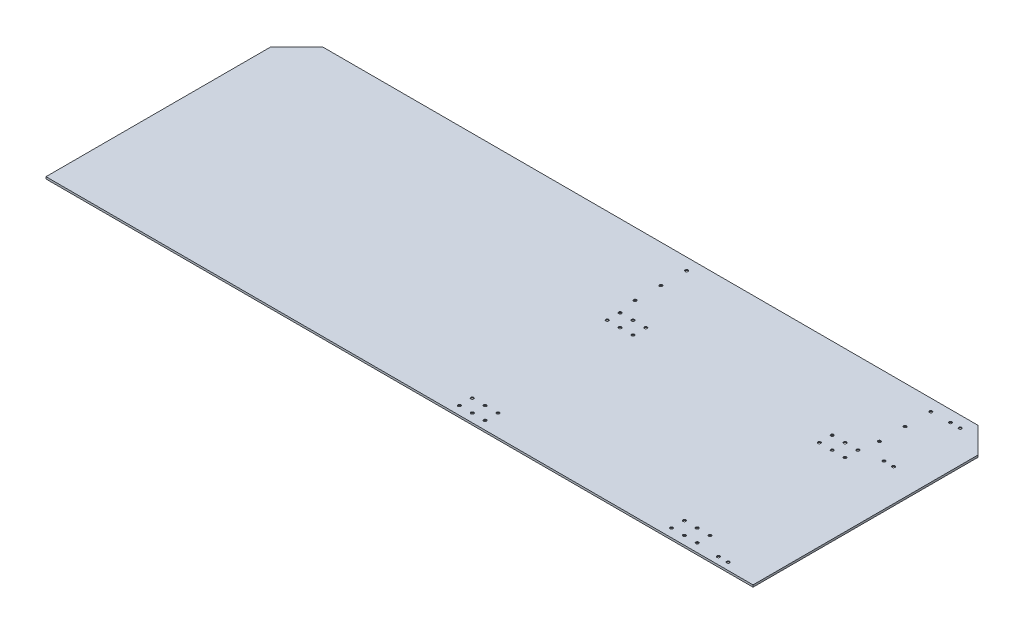
from build123d import *

# Parameters (mm, degrees)
SKETCH1_W                       = 1100
SKETCH1_H                       = 390
BOSS_EXTRUDE1_DEPTH             = 3.175
CHAMFER1_SIZE                   = 40
LAPTOP_SUPPORT_HOLES_AT_2_COUNT = 2
LAPTOP_SUPPORT_HOLES_AT_2_PITCH = 20
LAPTOP_SUPPORT_HOLES_AT_3_COUNT = 2
LAPTOP_SUPPORT_HOLES_AT_3_PITCH = 40
LAPTOP_SUPPORT_HOLES_AT_4_COUNT = 2
LAPTOP_SUPPORT_HOLES_AT_4_PITCH = 28.284271247
LAPTOP_SUPPORT_HOLES_AT_5_COUNT = 2
LAPTOP_SUPPORT_HOLES_AT_5_PITCH = 44.72135955
LAPTOP_SUPPORT_HOLES_AT_6_COUNT = 2
LAPTOP_SUPPORT_HOLES_AT_6_PITCH = 20
LPATTERN1_COUNT                 = 2
LPATTERN1_PITCH                 = 330
LPATTERN1_COUNT_DIR2            = 2
LPATTERN1_PITCH_DIR2            = 230
FAN_SUPPORT_HOLES_AT_2_COUNT    = 2
FAN_SUPPORT_HOLES_AT_2_PITCH    = 15
FAN_SUPPORT_HOLES_AT_3_COUNT    = 2
FAN_SUPPORT_HOLES_AT_3_PITCH    = 103.65
FAN_SUPPORT_HOLES_AT_4_COUNT    = 2
FAN_SUPPORT_HOLES_AT_4_PITCH    = 104.729759381
FAN_SUPPORT_HOLES_AT_5_COUNT    = 2
FAN_SUPPORT_HOLES_AT_5_PITCH    = 257.5
FAN_SUPPORT_HOLES_AT_6_COUNT    = 2
FAN_SUPPORT_HOLES_AT_6_PITCH    = 257.936523199
BACK_BAY_HOLES_AT_2_COUNT       = 2
BACK_BAY_HOLES_AT_2_PITCH       = 40
BACK_BAY_HOLES_AT_3_COUNT       = 2
BACK_BAY_HOLES_AT_3_PITCH       = 80
LPATTERN3_COUNT                 = 2
LPATTERN3_PITCH                 = 380


with BuildPart() as part:
    # Sketch1 → Boss-Extrude1 (new body)
    with BuildSketch(Plane(origin=(0, 0, 0), x_dir=(1, 0, 0), z_dir=(0, 1, 0))):
        Rectangle(SKETCH1_W, SKETCH1_H)
    extrude(amount=BOSS_EXTRUDE1_DEPTH)

    # Chamfer1
    chamfer1_edges = [part.edges().sort_by_distance(p)[0] for p in [
        (-550, 1.5875, -195),
        (550, 1.5875, -195),
    ]]
    chamfer(chamfer1_edges, length=CHAMFER1_SIZE)

    # Sketch13 → Laptop Support Holes (revolve, cut)
    with BuildSketch(Plane(origin=(450, 0, 181.825), x_dir=(0, 0, -1), z_dir=(1, 0, 0))):
        Polygon((0, 0), (0, 16.351936393), (2.25, 15), (2.25, 2.23), (4.48, 0), align=None)
    laptop_support_holes = revolve(axis=Axis((450, -6.35, 181.825), (0, 1, 0)), mode=Mode.SUBTRACT)

    # Laptop Support Holes at 2: Laptop Support Holes ×2
    with Locations(*[(-i * LAPTOP_SUPPORT_HOLES_AT_2_PITCH, 0, 0) for i in range(1, LAPTOP_SUPPORT_HOLES_AT_2_COUNT)]):
        add(laptop_support_holes, mode=Mode.SUBTRACT)

    # Laptop Support Holes at 3: Laptop Support Holes ×2
    with Locations(*[(-i * LAPTOP_SUPPORT_HOLES_AT_3_PITCH, 0, 0) for i in range(1, LAPTOP_SUPPORT_HOLES_AT_3_COUNT)]):
        add(laptop_support_holes, mode=Mode.SUBTRACT)

    # Laptop Support Holes at 4: Laptop Support Holes ×2
    with Locations(*[Vector(-0.7071067811865456, 0, -0.7071067811865496) * (i * LAPTOP_SUPPORT_HOLES_AT_4_PITCH) for i in range(1, LAPTOP_SUPPORT_HOLES_AT_4_COUNT)]):
        add(laptop_support_holes, mode=Mode.SUBTRACT)

    # Laptop Support Holes at 5: Laptop Support Holes ×2
    with Locations(*[Vector(-0.8944271909999156, 0, -0.4472135954999585) * (i * LAPTOP_SUPPORT_HOLES_AT_5_PITCH) for i in range(1, LAPTOP_SUPPORT_HOLES_AT_5_COUNT)]):
        add(laptop_support_holes, mode=Mode.SUBTRACT)

    # Laptop Support Holes at 6: Laptop Support Holes ×2
    with Locations(*[(0, 0, -i * LAPTOP_SUPPORT_HOLES_AT_6_PITCH) for i in range(1, LAPTOP_SUPPORT_HOLES_AT_6_COUNT)]):
        add(laptop_support_holes, mode=Mode.SUBTRACT)

    # LPattern1: Laptop Support Holes 2 × 2
    with Locations(*[(-i * LPATTERN1_PITCH, 0, -j * LPATTERN1_PITCH_DIR2) for i in range(LPATTERN1_COUNT) for j in range(LPATTERN1_COUNT_DIR2) if (i, j) != (0, 0)]):
        add(laptop_support_holes, mode=Mode.SUBTRACT)

    # LPattern1 copy 1 sketch → LPattern1 copy 1 (revolve, cut)
    with BuildSketch(Plane(origin=(430, 0, -48.175), x_dir=(0, 0, -1), z_dir=(1, 0, 0))):
        Polygon((0, 0), (0, 16.351936393), (2.25, 15), (2.25, 2.23), (4.48, 0), align=None)
    revolve(axis=Axis((430, -6.35, -48.175), (0, 1, 0)), mode=Mode.SUBTRACT)

    # LPattern1 copy 2 sketch → LPattern1 copy 2 (revolve, cut)
    with BuildSketch(Plane(origin=(100, 0, 181.825), x_dir=(0, 0, -1), z_dir=(1, 0, 0))):
        Polygon((0, 0), (0, 16.351936393), (2.25, 15), (2.25, 2.23), (4.48, 0), align=None)
    revolve(axis=Axis((100, -6.35, 181.825), (0, 1, 0)), mode=Mode.SUBTRACT)

    # LPattern1 copy 3 sketch → LPattern1 copy 3 (revolve, cut)
    with BuildSketch(Plane(origin=(100, 0, -48.175), x_dir=(0, 0, -1), z_dir=(1, 0, 0))):
        Polygon((0, 0), (0, 16.351936393), (2.25, 15), (2.25, 2.23), (4.48, 0), align=None)
    revolve(axis=Axis((100, -6.35, -48.175), (0, 1, 0)), mode=Mode.SUBTRACT)

    # LPattern1 copy 4 sketch → LPattern1 copy 4 (revolve, cut)
    with BuildSketch(Plane(origin=(410, 0, -48.175), x_dir=(0, 0, -1), z_dir=(1, 0, 0))):
        Polygon((0, 0), (0, 16.351936393), (2.25, 15), (2.25, 2.23), (4.48, 0), align=None)
    revolve(axis=Axis((410, -6.35, -48.175), (0, 1, 0)), mode=Mode.SUBTRACT)

    # LPattern1 copy 5 sketch → LPattern1 copy 5 (revolve, cut)
    with BuildSketch(Plane(origin=(80, 0, 181.825), x_dir=(0, 0, -1), z_dir=(1, 0, 0))):
        Polygon((0, 0), (0, 16.351936393), (2.25, 15), (2.25, 2.23), (4.48, 0), align=None)
    revolve(axis=Axis((80, -6.35, 181.825), (0, 1, 0)), mode=Mode.SUBTRACT)

    # LPattern1 copy 6 sketch → LPattern1 copy 6 (revolve, cut)
    with BuildSketch(Plane(origin=(80, 0, -48.175), x_dir=(0, 0, -1), z_dir=(1, 0, 0))):
        Polygon((0, 0), (0, 16.351936393), (2.25, 15), (2.25, 2.23), (4.48, 0), align=None)
    revolve(axis=Axis((80, -6.35, -48.175), (0, 1, 0)), mode=Mode.SUBTRACT)

    # LPattern1 copy 7 sketch → LPattern1 copy 7 (revolve, cut)
    with BuildSketch(Plane(origin=(430, 0, -68.175), x_dir=(0, 0, -1), z_dir=(1, 0, 0))):
        Polygon((0, 0), (0, 16.351936393), (2.25, 15), (2.25, 2.23), (4.48, 0), align=None)
    revolve(axis=Axis((430, -6.35, -68.175), (0, 1, 0)), mode=Mode.SUBTRACT)

    # LPattern1 copy 8 sketch → LPattern1 copy 8 (revolve, cut)
    with BuildSketch(Plane(origin=(100, 0, 161.825), x_dir=(0, 0, -1), z_dir=(1, 0, 0))):
        Polygon((0, 0), (0, 16.351936393), (2.25, 15), (2.25, 2.23), (4.48, 0), align=None)
    revolve(axis=Axis((100, -6.35, 161.825), (0, 1, 0)), mode=Mode.SUBTRACT)

    # LPattern1 copy 9 sketch → LPattern1 copy 9 (revolve, cut)
    with BuildSketch(Plane(origin=(100, 0, -68.175), x_dir=(0, 0, -1), z_dir=(1, 0, 0))):
        Polygon((0, 0), (0, 16.351936393), (2.25, 15), (2.25, 2.23), (4.48, 0), align=None)
    revolve(axis=Axis((100, -6.35, -68.175), (0, 1, 0)), mode=Mode.SUBTRACT)

    # LPattern1 copy 10 sketch → LPattern1 copy 10 (revolve, cut)
    with BuildSketch(Plane(origin=(410, 0, -68.175), x_dir=(0, 0, -1), z_dir=(1, 0, 0))):
        Polygon((0, 0), (0, 16.351936393), (2.25, 15), (2.25, 2.23), (4.48, 0), align=None)
    revolve(axis=Axis((410, -6.35, -68.175), (0, 1, 0)), mode=Mode.SUBTRACT)

    # LPattern1 copy 11 sketch → LPattern1 copy 11 (revolve, cut)
    with BuildSketch(Plane(origin=(80, 0, 161.825), x_dir=(0, 0, -1), z_dir=(1, 0, 0))):
        Polygon((0, 0), (0, 16.351936393), (2.25, 15), (2.25, 2.23), (4.48, 0), align=None)
    revolve(axis=Axis((80, -6.35, 161.825), (0, 1, 0)), mode=Mode.SUBTRACT)

    # LPattern1 copy 12 sketch → LPattern1 copy 12 (revolve, cut)
    with BuildSketch(Plane(origin=(80, 0, -68.175), x_dir=(0, 0, -1), z_dir=(1, 0, 0))):
        Polygon((0, 0), (0, 16.351936393), (2.25, 15), (2.25, 2.23), (4.48, 0), align=None)
    revolve(axis=Axis((80, -6.35, -68.175), (0, 1, 0)), mode=Mode.SUBTRACT)

    # LPattern1 copy 13 sketch → LPattern1 copy 13 (revolve, cut)
    with BuildSketch(Plane(origin=(450, 0, -68.175), x_dir=(0, 0, -1), z_dir=(1, 0, 0))):
        Polygon((0, 0), (0, 16.351936393), (2.25, 15), (2.25, 2.23), (4.48, 0), align=None)
    revolve(axis=Axis((450, -6.35, -68.175), (0, 1, 0)), mode=Mode.SUBTRACT)

    # LPattern1 copy 14 sketch → LPattern1 copy 14 (revolve, cut)
    with BuildSketch(Plane(origin=(120, 0, 161.825), x_dir=(0, 0, -1), z_dir=(1, 0, 0))):
        Polygon((0, 0), (0, 16.351936393), (2.25, 15), (2.25, 2.23), (4.48, 0), align=None)
    revolve(axis=Axis((120, -6.35, 161.825), (0, 1, 0)), mode=Mode.SUBTRACT)

    # LPattern1 copy 15 sketch → LPattern1 copy 15 (revolve, cut)
    with BuildSketch(Plane(origin=(120, 0, -68.175), x_dir=(0, 0, -1), z_dir=(1, 0, 0))):
        Polygon((0, 0), (0, 16.351936393), (2.25, 15), (2.25, 2.23), (4.48, 0), align=None)
    revolve(axis=Axis((120, -6.35, -68.175), (0, 1, 0)), mode=Mode.SUBTRACT)

    # Sketch16 → Fan Support Holes (revolve, cut)
    with BuildSketch(Plane(origin=(500, 0, -73.675), x_dir=(0, 0, -1), z_dir=(1, 0, 0))):
        Polygon((0, 0), (0, 3.175), (2.25, 3.175), (2.25, 2.23), (4.48, 0), align=None)
    fan_support_holes = revolve(axis=Axis((500, -6.35, -73.675), (0, 1, 0)), mode=Mode.SUBTRACT)

    # Fan Support Holes at 2: Fan Support Holes ×2
    with Locations(*[(-i * FAN_SUPPORT_HOLES_AT_2_PITCH, 0, 0) for i in range(1, FAN_SUPPORT_HOLES_AT_2_COUNT)]):
        add(fan_support_holes, mode=Mode.SUBTRACT)

    # Fan Support Holes at 3: Fan Support Holes ×2
    with Locations(*[(0, 0, -i * FAN_SUPPORT_HOLES_AT_3_PITCH) for i in range(1, FAN_SUPPORT_HOLES_AT_3_COUNT)]):
        add(fan_support_holes, mode=Mode.SUBTRACT)

    # Fan Support Holes at 4: Fan Support Holes ×2
    with Locations(*[Vector(-0.14322576590128938, 0, -0.9896900423779099) * (i * FAN_SUPPORT_HOLES_AT_4_PITCH) for i in range(1, FAN_SUPPORT_HOLES_AT_4_COUNT)]):
        add(fan_support_holes, mode=Mode.SUBTRACT)

    # Fan Support Holes at 5: Fan Support Holes ×2
    with Locations(*[(0, 0, i * FAN_SUPPORT_HOLES_AT_5_PITCH) for i in range(1, FAN_SUPPORT_HOLES_AT_5_COUNT)]):
        add(fan_support_holes, mode=Mode.SUBTRACT)

    # Fan Support Holes at 6: Fan Support Holes ×2
    with Locations(*[Vector(-0.05815384271279048, 0, 0.9983076332362365) * (i * FAN_SUPPORT_HOLES_AT_6_PITCH) for i in range(1, FAN_SUPPORT_HOLES_AT_6_COUNT)]):
        add(fan_support_holes, mode=Mode.SUBTRACT)

    # Sketch21 → Back Bay Holes (revolve, cut)
    with BuildSketch(Plane(origin=(455, 0, -176.585), x_dir=(0, 0, -1), z_dir=(1, 0, 0))):
        Polygon((0, 0), (0, 13.351936393), (2.25, 12), (2.25, 2.23), (4.48, 0), align=None)
    back_bay_holes = revolve(axis=Axis((455, -6.35, -176.585), (0, 1, 0)), mode=Mode.SUBTRACT)

    # Back Bay Holes at 2: Back Bay Holes ×2
    with Locations(*[(0, 0, i * BACK_BAY_HOLES_AT_2_PITCH) for i in range(1, BACK_BAY_HOLES_AT_2_COUNT)]):
        add(back_bay_holes, mode=Mode.SUBTRACT)

    # Back Bay Holes at 3: Back Bay Holes ×2
    with Locations(*[(0, 0, i * BACK_BAY_HOLES_AT_3_PITCH) for i in range(1, BACK_BAY_HOLES_AT_3_COUNT)]):
        add(back_bay_holes, mode=Mode.SUBTRACT)

    # LPattern3: Back Bay Holes ×2
    with Locations(*[(-i * LPATTERN3_PITCH, 0, 0) for i in range(1, LPATTERN3_COUNT)]):
        add(back_bay_holes, mode=Mode.SUBTRACT)

    # LPattern3 copy 1 sketch → LPattern3 copy 1 (revolve, cut)
    with BuildSketch(Plane(origin=(75, 0, -136.585), x_dir=(0, 0, -1), z_dir=(1, 0, 0))):
        Polygon((0, 0), (0, 13.351936393), (2.25, 12), (2.25, 2.23), (4.48, 0), align=None)
    revolve(axis=Axis((75, -6.35, -136.585), (0, 1, 0)), mode=Mode.SUBTRACT)

    # LPattern3 copy 2 sketch → LPattern3 copy 2 (revolve, cut)
    with BuildSketch(Plane(origin=(75, 0, -96.585), x_dir=(0, 0, -1), z_dir=(1, 0, 0))):
        Polygon((0, 0), (0, 13.351936393), (2.25, 12), (2.25, 2.23), (4.48, 0), align=None)
    revolve(axis=Axis((75, -6.35, -96.585), (0, 1, 0)), mode=Mode.SUBTRACT)


solid = part.part
